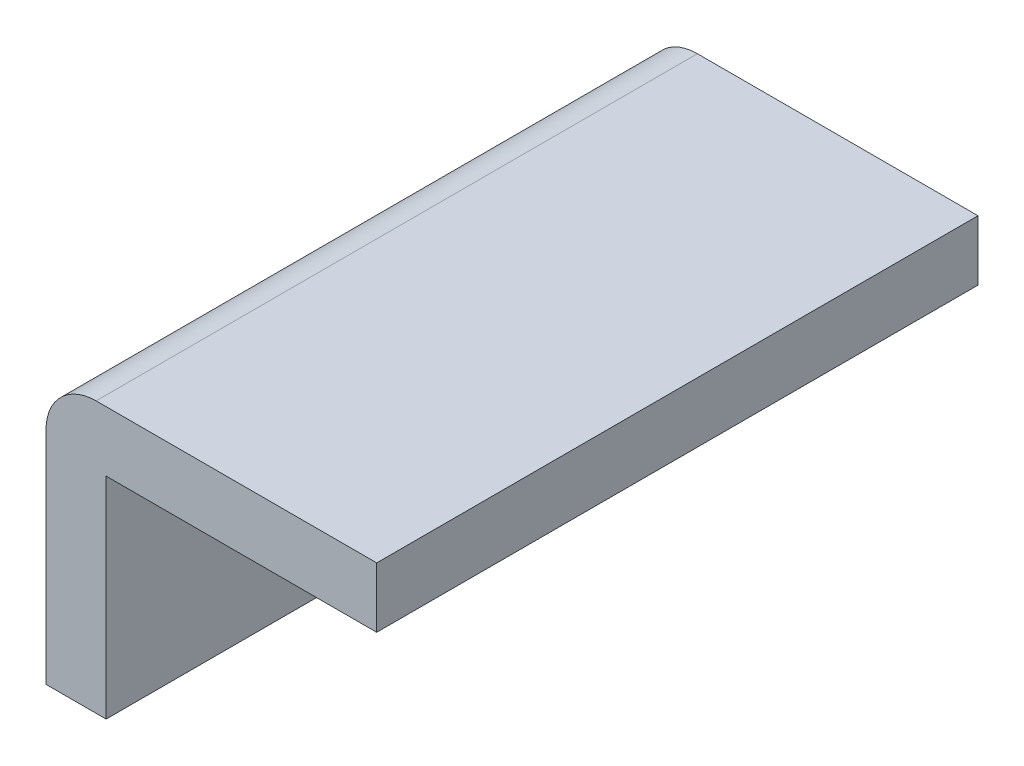
from build123d import *

# Parameters (mm, degrees)
BOSS_EXTRUDE1_DEPTH = 30


with BuildPart() as part:
    # Sketch1 → Boss-Extrude1 (new body)
    with BuildSketch(Plane.XY):
        with BuildLine():
            Line((-1.5, 0), (1.5, 0))
            Line((1.5, 0), (1.5, 10.5))
            Line((1.5, 10.5), (15, 10.5))
            Line((15, 10.5), (15, 13.5))
            Line((15, 13.5), (1, 13.5))
            ThreePointArc((1, 13.5), (-0.767766953, 12.767766953), (-1.5, 11))
            Line((-1.5, 11), (-1.5, 0))
        make_face()
    extrude(amount=BOSS_EXTRUDE1_DEPTH)


solid = part.part
